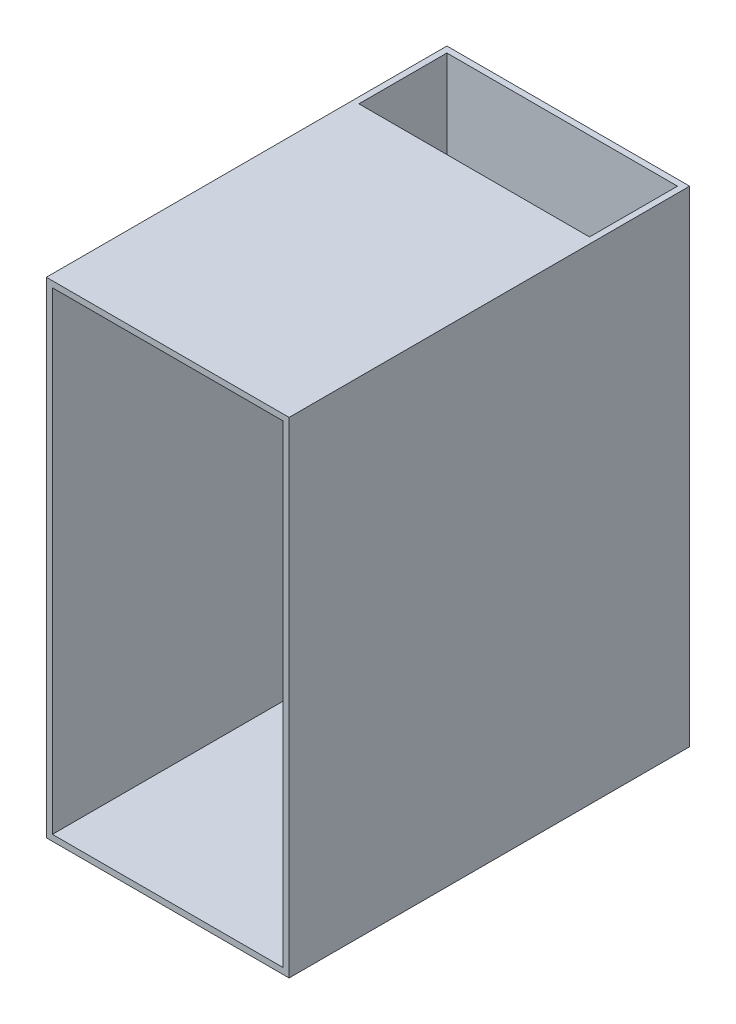
from build123d import *

# Parameters (mm, degrees)
SKETCH1_W           = 80
SKETCH1_H           = 160
BOSS_EXTRUDE1_DEPTH = 2
SKETCH2_W           = 80
SKETCH2_H           = 160
SKETCH2_W_2         = 76
SKETCH2_H_2         = 156
BOSS_EXTRUDE2_DEPTH = 130
SKETCH3_W           = 62
SKETCH3_H           = 18
CUT_EXTRUDE1_DEPTH  = 2
SKETCH5_W           = 76
SKETCH5_H           = 29
CUT_EXTRUDE2_DEPTH  = 2
SKETCH7_W           = 76
SKETCH7_H           = 10
BOSS_EXTRUDE3_DEPTH = 20
CHAMFER1_SIZE       = 17
FILLET1_R           = 10


with BuildPart() as part:
    # Sketch1 → Boss-Extrude1 (new body)
    with BuildSketch(Plane.XY):
        Rectangle(SKETCH1_W, SKETCH1_H)
    extrude(amount=BOSS_EXTRUDE1_DEPTH)

    # Sketch2 → Boss-Extrude2 (add)
    with BuildSketch(Plane.XY.offset(2)):
        Rectangle(SKETCH2_W, SKETCH2_H)
        Rectangle(SKETCH2_W_2, SKETCH2_H_2, mode=Mode.SUBTRACT)
    extrude(amount=BOSS_EXTRUDE2_DEPTH)

    # Sketch3 → Cut-Extrude1 (cut)
    with BuildSketch(Plane.XZ.offset(80)):
        with Locations((0, 11)):
            Rectangle(SKETCH3_W, SKETCH3_H)
    extrude(amount=-CUT_EXTRUDE1_DEPTH, mode=Mode.SUBTRACT)

    # Sketch5 → Cut-Extrude2 (cut)
    with BuildSketch(Plane(origin=(0, 80, 0), x_dir=(1, 0, 0), z_dir=(0, 1, 0))):
        with Locations((0, -16.5)):
            Rectangle(SKETCH5_W, SKETCH5_H)
    extrude(amount=-CUT_EXTRUDE2_DEPTH, mode=Mode.SUBTRACT)

    # Sketch7 → Boss-Extrude3 (add)
    with BuildSketch(Plane(origin=(0, -78, 0), x_dir=(1, 0, 0), z_dir=(0, 1, 0))):
        with Locations((0, -25)):
            Rectangle(SKETCH7_W, SKETCH7_H)
    extrude(amount=BOSS_EXTRUDE3_DEPTH)

    # Chamfer1
    # the kernel refuses this chamfer: 17 mm, written as the material it takes off along each edge
    with BuildSketch(Plane(origin=(38, -58, 30), x_dir=(0, 0.027495876610586237, -0.9996219169112966), z_dir=(-1, 0, 0))) as chamfer1_piece_1:
        Polygon((CHAMFER1_SIZE * 0.999621916911, CHAMFER1_SIZE * 0.0274958766106), (-CHAMFER1_SIZE * 0.0274958766106, CHAMFER1_SIZE * 0.999621916911), (0, 0), align=None)
    extrude(amount=76, mode=Mode.SUBTRACT)

    # Fillet1
    # the kernel refuses this fillet: 10 mm, written as the material it takes off along each edge
    with BuildSketch(Plane(origin=(38, -75, 30), x_dir=(0, -1.0, 2.265447089177998e-12), z_dir=(-1, 0, 0))) as fillet1_piece_1:
        with BuildLine():
            CenterArc((4.216391769, -9.925743854), FILLET1_R, 96.986713585, 38.013286415)
            Line((-2.854676043, -2.854676043), (0, 0))
            Line((0, 0), (3, 0))
        make_face()
    extrude(amount=76, mode=Mode.SUBTRACT)


solid = part.part
